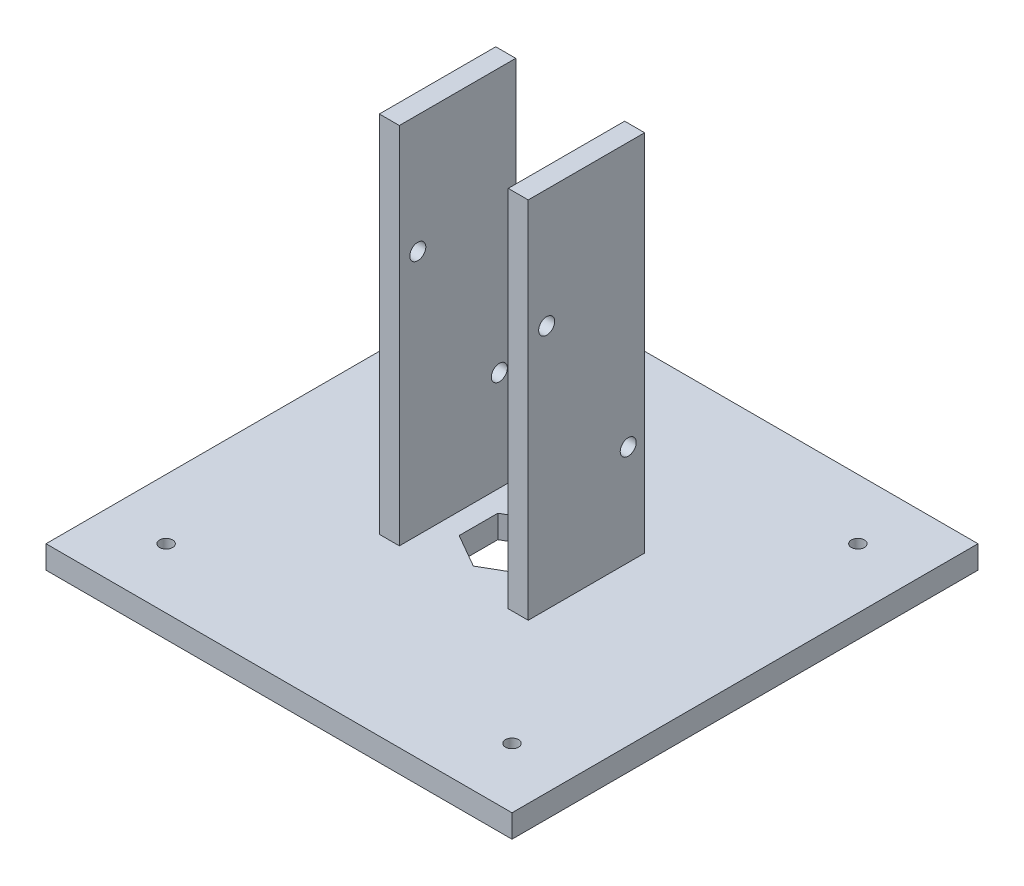
from build123d import *

# Parameters (mm, degrees)
SKETCH2_W           = 162.56
SKETCH2_H           = 162.56
SKETCH2_R           = 2.286
BOSS_EXTRUDE1_DEPTH = 8
SKETCH7_W           = 6.970809858
SKETCH7_H           = 40.604866776
BOSS_EXTRUDE3_DEPTH = 127
SKETCH8_R           = 2.794
CUT_EXTRUDE1_DEPTH  = 194.794080486


with BuildPart() as part:
    # Sketch2 → Boss-Extrude1 (new body)
    with BuildSketch(Plane(origin=(0, 0, 0), x_dir=(1, 0, 0), z_dir=(0, 1, 0))):
        Rectangle(SKETCH2_W, SKETCH2_H)
        with Locations((-60.325, -60.325)):
            Circle(SKETCH2_R, mode=Mode.SUBTRACT)
        with Locations((60.325, -60.325)):
            Circle(SKETCH2_R, mode=Mode.SUBTRACT)
        Polygon((-11.684, 6.745760545), (0, 13.49152109), (11.684, 6.745760545), (11.684, -6.745760545), (0, -13.49152109), (-11.684, -6.745760545), align=None, mode=Mode.SUBTRACT)
        with Locations((-60.325, 60.325)):
            Circle(SKETCH2_R, mode=Mode.SUBTRACT)
        with Locations((60.325, 60.325)):
            Circle(SKETCH2_R, mode=Mode.SUBTRACT)
    extrude(amount=BOSS_EXTRUDE1_DEPTH)

    # Sketch7 → Boss-Extrude3 (add)
    with BuildSketch(Plane(origin=(0, 8, 0), x_dir=(1, 0, 0), z_dir=(0, 1, 0))):
        with Locations((-22.479, 0)):
            Rectangle(SKETCH7_W, SKETCH7_H)
    boss_extrude3 = extrude(amount=BOSS_EXTRUDE3_DEPTH)

    # Mirror1: Boss-Extrude3 across plane
    add(boss_extrude3.mirror(Plane(origin=(0, 0, 0), x_dir=(0, 0, 1), z_dir=(1, 0, 0))))

    # Sketch8 → Cut-Extrude1 (cut, through all)
    with BuildSketch(Plane(origin=(25.964404929, 0, -7.206062421), x_dir=(0, 0, 1), z_dir=(-1, 0, 0))):
        with Locations((21.070340028, 93.725)):
            Circle(SKETCH8_R)
        with Locations((-7.377659972, 42.925)):
            Circle(SKETCH8_R)
    extrude(amount=CUT_EXTRUDE1_DEPTH, mode=Mode.SUBTRACT)


solid = part.part
